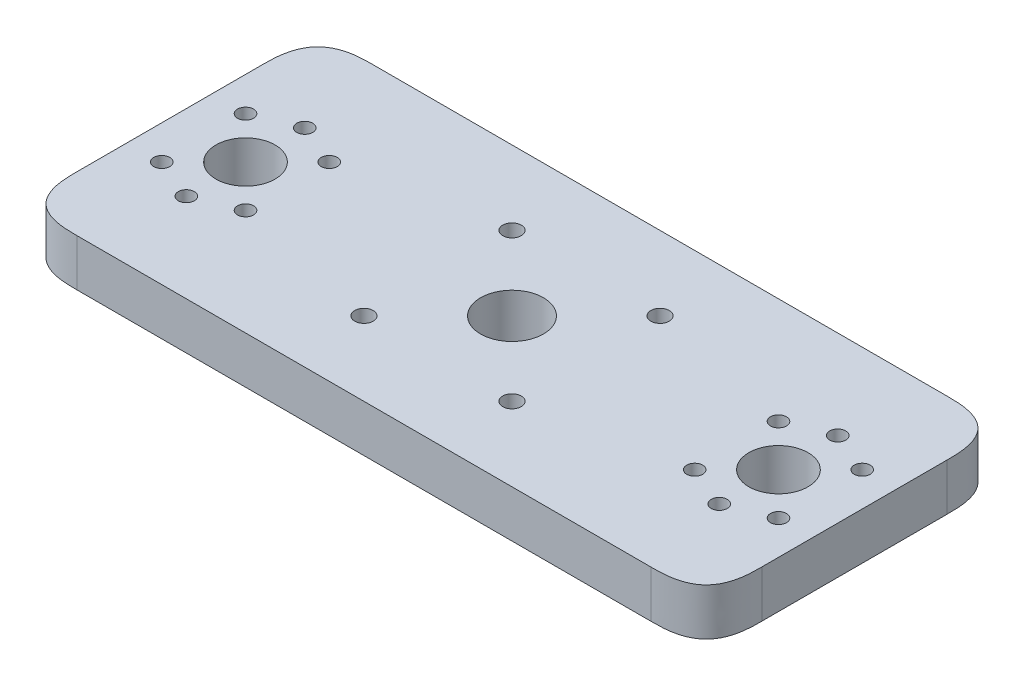
from build123d import *

# Parameters (mm, degrees)
SKETCH1_W                     = 185
SKETCH1_H                     = 80
BOSS_EXTRUDE1_DEPTH           = 12.7
M16_CLEARANCE_HOLE1_D         = 17
M6X1_0_START                  = -1
M6X1_0_TAPPED_HOLE2_OUTLINE_R = 2.5
M6X1_0_TAPPED_HOLE2_DEPTH     = 15
FILLET1_SIZE                  = 15
SKETCH5_R                     = 8
CUT_EXTRUDE1_DEPTH            = 102.575292414
M4_CLEARANCE_HOLE1_D          = 4.32


with BuildPart() as part:
    # Sketch1 → Boss-Extrude1 (new body)
    with BuildSketch(Plane(origin=(0, 0, 0), x_dir=(1, 0, 0), z_dir=(0, 1, 0))):
        Rectangle(SKETCH1_W, SKETCH1_H)
    extrude(amount=BOSS_EXTRUDE1_DEPTH)

    # M16 Clearance Hole1 (through all)
    with Locations(Plane(origin=(0, 12.7, 0), x_dir=(1, 0, 0), z_dir=(0, 1, 0))):
        with Locations((0, 0)):
            Hole(M16_CLEARANCE_HOLE1_D / 2)

    # M6x1.0 Tapped Hole2: read off the stored shape, not the designer's step
    # M6x1.0 Tapped Hole2 outline → M6x1.0 Tapped Hole2 (cut)
    with BuildSketch(Plane(origin=(0, 0, 0), x_dir=(1, 0, 0), z_dir=(0, 1, 0)).offset(M6X1_0_START)):
        with Locations((20, 20)):
            Circle(M6X1_0_TAPPED_HOLE2_OUTLINE_R)
        with Locations((-20, -20)):
            Circle(M6X1_0_TAPPED_HOLE2_OUTLINE_R)
        with Locations((20, -20)):
            Circle(M6X1_0_TAPPED_HOLE2_OUTLINE_R)
        with Locations((-20, 20)):
            Circle(M6X1_0_TAPPED_HOLE2_OUTLINE_R)
    extrude(amount=M6X1_0_TAPPED_HOLE2_DEPTH, mode=Mode.SUBTRACT)

    # Fillet1
    # a fillet whose section is not a circle: 15 mm, written as the material it takes off along each edge
    with BuildSketch(Plane(origin=(-92.5, -37.5, -40), x_dir=(1, 0, 0), z_dir=(0, 1, 0)), Plane(origin=(-92.5, -37.5, 40), x_dir=(0, 0, -1), z_dir=(0, 1, 0))) as fillet1_piece_1:
        with BuildLine():
            add(Edge.make_bspline([(FILLET1_SIZE, 0), (FILLET1_SIZE * 0.831801948466, 0), (FILLET1_SIZE * 0.663603896932, 0), (FILLET1_SIZE * 0.292893218813, -FILLET1_SIZE * 0.0716919198361), (FILLET1_SIZE * 0.0716919198361, -FILLET1_SIZE * 0.292893218813), (0, -FILLET1_SIZE * 0.663603896932), (0, -FILLET1_SIZE * 0.831801948466), (0, -FILLET1_SIZE)], knots=[0, 0, 0, 0, 0, 0, 0.5, 0.5, 1, 1, 1, 1, 1, 1], degree=5))
            Line((0, -FILLET1_SIZE), (0, 0))
            Line((0, 0), (FILLET1_SIZE, 0))
        make_face()
    extrude(amount=87.7, mode=Mode.SUBTRACT)
    with BuildSketch(Plane(origin=(92.5, -37.5, -40), x_dir=(-1, 0, 0), z_dir=(0, 1, 0)), Plane(origin=(92.5, -37.5, 40), x_dir=(0, 0, -1), z_dir=(0, 1, 0))) as fillet1_piece_2:
        with BuildLine():
            add(Edge.make_bspline([(FILLET1_SIZE, 0), (FILLET1_SIZE * 0.831801948466, 0), (FILLET1_SIZE * 0.663603896932, 0), (FILLET1_SIZE * 0.292893218813, FILLET1_SIZE * 0.0716919198361), (FILLET1_SIZE * 0.0716919198361, FILLET1_SIZE * 0.292893218813), (0, FILLET1_SIZE * 0.663603896932), (0, FILLET1_SIZE * 0.831801948466), (0, FILLET1_SIZE)], knots=[0, 0, 0, 0, 0, 0, 0.5, 0.5, 1, 1, 1, 1, 1, 1], degree=5))
            Line((0, FILLET1_SIZE), (0, 0))
            Line((0, 0), (FILLET1_SIZE, 0))
        make_face()
    extrude(amount=87.7, mode=Mode.SUBTRACT)

    # Sketch5 → Cut-Extrude1 (cut, through all)
    with BuildSketch(Plane(origin=(0, 12.7, 0), x_dir=(1, 0, 0), z_dir=(0, 1, 0))):
        with Locations(Location((-72, 0, 0), (0, 0, 270))):
            Circle(SKETCH5_R)
        with Locations(Location((72, 0, 0), (0, 0, 270))):
            Circle(SKETCH5_R)
    extrude(amount=-CUT_EXTRUDE1_DEPTH, mode=Mode.SUBTRACT)

    # M4 Clearance Hole1 (through all)
    with Locations(Plane(origin=(0, 0, 0), x_dir=(-1, 0, 0), z_dir=(0, -1, 0))):
        with Locations((60.686291501, 11.313708499), (72, 16), (83.313708499, 11.313708499), (60.686291501, -11.313708499), (72, -16), (83.313708499, -11.313708499), (-83.313708499, -11.313708499), (-72, -16), (-60.686291501, -11.313708499), (-60.686291501, 11.313708499), (-83.313708499, 11.313708499), (-72, 16)):
            Hole(M4_CLEARANCE_HOLE1_D / 2)


solid = part.part
